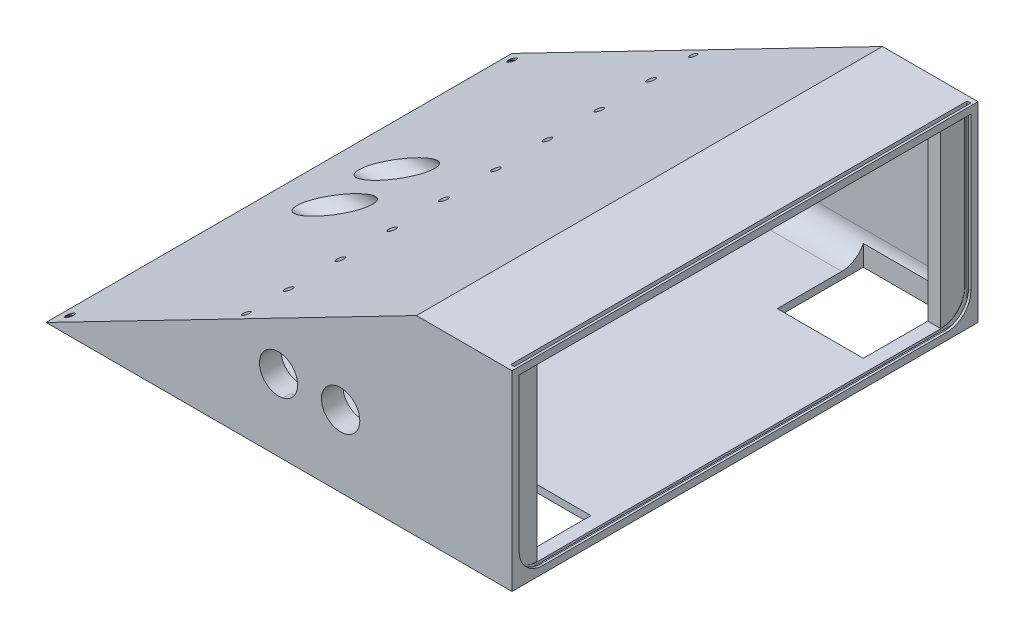
from build123d import *

# Parameters (mm, degrees)
ROBOT_DEPTH                 = 195
VACIO_POR_DENTRO_3MM_T      = -3
SKETCH3_R                   = 8.02
ULTRASONICO_DERECHA_DEPTH   = 3
SKETCH9_R                   = 8.2
ULTRASONICO_IZQUIERDA_DEPTH = 3
ULTRASONICO_CENTRO_R        = 8.7
CUT_EXTRUDE4_DEPTH          = 75
SKETCH16_R                  = 8.685660505
SKETCH16_R_2                = 8.02
BOSS_EXTRUDE1_DEPTH         = 9
SKETCH18_R                  = 8.7
SKETCH18_R_2                = 8.2
SKETCH18_R_3                = 8.719213476
BOSS_EXTRUDE2_DEPTH         = 60
SKETCH10_W                  = 37
SKETCH10_H                  = 37
RUEDA_DERECHA_DEPTH         = 3
SKETCH12_W                  = 36
SKETCH12_H                  = 36
RUEDA_IZQUIERDA_DEPTH       = 3
SKETCH14_W                  = 7.1
SKETCH14_H                  = 7.1
CYN70_DERECHA_DEPTH         = 4
SKETCH15_W                  = 7.1
SKETCH15_H                  = 7.1
CNY70_CENTRO_DEPTH          = 4
SKETCH13_W                  = 7.1
SKETCH13_H                  = 7.1
CNY70_IZQUIERDA_DEPTH       = 4
RDONDEO_R                   = 10
SKETCH23_W                  = 76.592532913
SKETCH23_H                  = 65.967934853
CUT_EXTRUDE5_DEPTH          = 25
SKETCH24_W                  = 1.5
SKETCH24_H                  = 191
CUT_EXTRUDE6_DEPTH          = 78
SKETCH25_W                  = 5.39966948
SKETCH25_H                  = 12.093031456
BOSS_EXTRUDE3_DEPTH         = 75
SKETCH38_W                  = 8.026655699
SKETCH38_H                  = 8.306480136
SKETCH38_W_2                = 7.026655699
SKETCH38_H_2                = 7.306480136
SKETCH38_H_3                = 8.585210253
SKETCH38_H_4                = 7.585210253
SKETCH38_H_5                = 8.264160011
SKETCH38_H_6                = 7.264160011
BOSS_EXTRUDE4_DEPTH         = 6
SKETCH40_R                  = 1.7
SKETCH40_R_2                = 1.52
AGUJEROS_RAMPA_DEPTH        = 3


with BuildPart() as part:
    # Sketch2 → Robot (new body)
    with BuildSketch(Plane.XY):
        Polygon((0, 0), (195, 0), (195, 80), (155, 80), align=None)
    extrude(amount=ROBOT_DEPTH)

    # Vacio por dentro 3mm
    vacio_por_dentro_3mm_openings = [part.faces().sort_by_distance(p)[0] for p in [
        (195, 40, 97.5),
    ]]
    offset(amount=VACIO_POR_DENTRO_3MM_T, openings=vacio_por_dentro_3mm_openings, kind=Kind.INTERSECTION)

    # Sketch3 → Ultrasonico Derecha (cut)
    with BuildSketch(Plane.XY.offset(195)):
        with Locations((97.289863967, 30)):
            Circle(SKETCH3_R)
        with Locations((123.289863967, 30)):
            Circle(SKETCH3_R)
    extrude(amount=-ULTRASONICO_DERECHA_DEPTH, mode=Mode.SUBTRACT)

    # Sketch9 → Ultrasonico Izquierda (cut)
    with BuildSketch(Plane(origin=(0, 0, 0), x_dir=(-1, 0, 0), z_dir=(0, 0, -1))):
        with Locations((-97.284004153, 30)):
            Circle(SKETCH9_R)
        with Locations((-123.284004153, 30)):
            Circle(SKETCH9_R)
    extrude(amount=-ULTRASONICO_IZQUIERDA_DEPTH, mode=Mode.SUBTRACT)

    # Ultrasonico Centro → Cut-Extrude4 (cut)
    with BuildSketch(Plane(origin=(0, 0, 0), x_dir=(0, 0, -1), z_dir=(1, 0, 0))):
        with Locations(Location((-85, 19, 0), (0, 0, 270))):
            Circle(ULTRASONICO_CENTRO_R)
        with Locations(Location((-111, 19, 0), (0, 0, 270))):
            Circle(ULTRASONICO_CENTRO_R)
    extrude(amount=CUT_EXTRUDE4_DEPTH, mode=Mode.SUBTRACT)

    # Sketch16 → Boss-Extrude1 (add)
    # profile 1 of 2: a face of its own
    with BuildSketch(Plane.XY.offset(195)):
        with Locations((123.289863967, 30)):
            Circle(SKETCH16_R)
        with Locations((123.289863967, 30)):
            Circle(SKETCH16_R_2, mode=Mode.SUBTRACT)
    # profile 2 of 2: a face of its own
    with BuildSketch(Plane.XY.offset(195)):
        with Locations((97.335124092, 30.010684101)):
            Circle(SKETCH16_R)
        with Locations((97.335124092, 30.010684101)):
            Circle(SKETCH16_R_2, mode=Mode.SUBTRACT)
    boss_extrude1 = extrude(amount=-BOSS_EXTRUDE1_DEPTH)

    # Sketch18 → Boss-Extrude2 (add)
    # profile 1 of 2: a face of its own
    with BuildSketch(Plane(origin=(1, 0, 0), x_dir=(0, 0, -1), z_dir=(1, 0, 0))):
        with Locations(Location((-85, 19, 0), (0, 0, 270))):
            Circle(SKETCH18_R)
        with Locations((-85, 19)):
            Circle(SKETCH18_R_2, mode=Mode.SUBTRACT)
    # profile 2 of 2: a face of its own
    with BuildSketch(Plane(origin=(1, 0, 0), x_dir=(0, 0, -1), z_dir=(1, 0, 0))):
        with Locations(Location((-111, 19, 0), (0, 0, 270))):
            Circle(SKETCH18_R_3)
        with Locations((-111, 19)):
            Circle(SKETCH18_R_2, mode=Mode.SUBTRACT)
    extrude(amount=BOSS_EXTRUDE2_DEPTH)

    # Mirror1: Boss-Extrude1 across plane
    add(boss_extrude1.mirror(Plane.XY.offset(97.5)))

    # Sketch10 → Rueda Derecha (cut)
    with BuildSketch(Plane(origin=(0, 0, 0), x_dir=(-1, 0, 0), z_dir=(0, -1, 0))):
        with Locations((-168.5, -172.5)):
            Rectangle(SKETCH10_W, SKETCH10_H)
    extrude(amount=-RUEDA_DERECHA_DEPTH, mode=Mode.SUBTRACT)

    # Sketch12 → Rueda Izquierda (cut)
    with BuildSketch(Plane(origin=(0, 0, 0), x_dir=(-1, 0, 0), z_dir=(0, -1, 0))):
        with Locations((-169, -22)):
            Rectangle(SKETCH12_W, SKETCH12_H)
    extrude(amount=-RUEDA_IZQUIERDA_DEPTH, mode=Mode.SUBTRACT)

    # Sketch14 → Cyn70 Derecha (cut)
    with BuildSketch(Plane(origin=(0, 0, 0), x_dir=(-1, 0, 0), z_dir=(0, -1, 0))):
        with Locations((-29.55, -183.45)):
            Rectangle(SKETCH14_W, SKETCH14_H)
    extrude(amount=-CYN70_DERECHA_DEPTH, mode=Mode.SUBTRACT)

    # Sketch15 → Cny70 Centro (cut)
    with BuildSketch(Plane(origin=(0, 0, 0), x_dir=(-1, 0, 0), z_dir=(0, -1, 0))):
        with Locations((-29.55, -97.5)):
            Rectangle(SKETCH15_W, SKETCH15_H)
    extrude(amount=-CNY70_CENTRO_DEPTH, mode=Mode.SUBTRACT)

    # Sketch13 → Cny70 Izquierda (cut)
    with BuildSketch(Plane.XZ):
        with Locations((29.55, 11.55)):
            Rectangle(SKETCH13_W, SKETCH13_H)
    extrude(amount=-CNY70_IZQUIERDA_DEPTH, mode=Mode.SUBTRACT)

    # Rdondeo
    # the kernel refuses this fillet: 10 mm, written as the material it adds along each edge
    with BuildSketch(Plane(origin=(-12.646463672, 3, 3), x_dir=(0, 0, 1), z_dir=(1, 0, 0))) as rdondeo_piece_1_section:
        with BuildLine():
            CenterArc((RDONDEO_R, -RDONDEO_R), RDONDEO_R, 90, 90)
            Line((0, -RDONDEO_R), (0, 0))
            Line((0, 0), (RDONDEO_R, 0))
        make_face()
    rdondeo_piece_1 = extrude(amount=232.646463672, mode=Mode.PRIVATE)
    rdondeo_piece_1 = split(rdondeo_piece_1, bisect_by=Plane(origin=(26, 3.382720795, 9.257724248), z_dir=(-1, 0, 0)), keep=Keep.TOP, mode=Mode.PRIVATE)
    rdondeo_piece_1 = split(rdondeo_piece_1, bisect_by=Plane(origin=(18.190230172, 6.012487145, 9.257724248), z_dir=(0.4586429197702524, -0.8886206570548638, 0)), keep=Keep.TOP, mode=Mode.PRIVATE)
    add(rdondeo_piece_1)
    with BuildSketch(Plane(origin=(-12.646463672, 3, 3), x_dir=(0, 0, 1), z_dir=(1, 0, 0))) as rdondeo_piece_2_section:
        with BuildLine():
            CenterArc((RDONDEO_R, -RDONDEO_R), RDONDEO_R, 90, 90)
            Line((0, -RDONDEO_R), (0, 0))
            Line((0, 0), (RDONDEO_R, 0))
        make_face()
    rdondeo_piece_2 = extrude(amount=232.646463672, mode=Mode.PRIVATE)
    rdondeo_piece_2 = split(rdondeo_piece_2, bisect_by=Plane(origin=(29.55, 4.766890381, 8), z_dir=(0, 0, -1)), keep=Keep.TOP, mode=Mode.PRIVATE)
    rdondeo_piece_2 = split(rdondeo_piece_2, bisect_by=Plane(origin=(151, 4.766890381, 5.549307676), z_dir=(-1, 0, 0)), keep=Keep.TOP, mode=Mode.PRIVATE)
    rdondeo_piece_2 = split(rdondeo_piece_2, bisect_by=Plane(origin=(26.652779728, 10.380254658, 5.549307676), z_dir=(0.4586429197702524, -0.8886206570548638, 0)), keep=Keep.TOP, mode=Mode.PRIVATE)
    add(rdondeo_piece_2)
    with BuildSketch(Plane(origin=(-12.646463672, 3, 3), x_dir=(0, 0, 1), z_dir=(1, 0, 0))) as rdondeo_piece_3_section:
        with BuildLine():
            CenterArc((RDONDEO_R, -RDONDEO_R), RDONDEO_R, 90, 90)
            Line((0, -RDONDEO_R), (0, 0))
            Line((0, 0), (RDONDEO_R, 0))
        make_face()
    rdondeo_piece_3 = extrude(amount=232.646463672, mode=Mode.PRIVATE)
    rdondeo_piece_3 = split(rdondeo_piece_3, bisect_by=Plane(origin=(33.1, 3.396845927, 9.232636126), z_dir=(1, 0, 0)), keep=Keep.TOP, mode=Mode.PRIVATE)
    rdondeo_piece_3 = split(rdondeo_piece_3, bisect_by=Plane(origin=(151, 3.396845927, 9.232636126), z_dir=(-1, 0, 0)), keep=Keep.TOP, mode=Mode.PRIVATE)
    add(rdondeo_piece_3)
    with BuildSketch(Plane(origin=(-12.646463672, 3, 3), x_dir=(0, 0, 1), z_dir=(1, 0, 0))) as rdondeo_piece_4_section:
        with BuildLine():
            CenterArc((RDONDEO_R, -RDONDEO_R), RDONDEO_R, 90, 90)
            Line((0, -RDONDEO_R), (0, 0))
            Line((0, 0), (RDONDEO_R, 0))
        make_face()
    rdondeo_piece_4 = extrude(amount=207.646463672, mode=Mode.PRIVATE)
    rdondeo_piece_4 = split(rdondeo_piece_4, bisect_by=Plane(origin=(187, 3.396845927, 9.232636126), z_dir=(1, 0, 0)), keep=Keep.TOP, mode=Mode.PRIVATE)
    add(rdondeo_piece_4)
    with BuildSketch(Plane(origin=(-12.646463672, 3, 3), x_dir=(0, 0, 1), z_dir=(1, 0, 0))) as rdondeo_piece_5_section:
        with BuildLine():
            CenterArc((RDONDEO_R, -RDONDEO_R), RDONDEO_R, 90, 90)
            Line((0, -RDONDEO_R), (0, 0))
            Line((0, 0), (RDONDEO_R, 0))
        make_face()
    rdondeo_piece_5 = extrude(amount=232.646463672, mode=Mode.PRIVATE)
    rdondeo_piece_5 = split(rdondeo_piece_5, bisect_by=Plane(origin=(187, 6.605810426, 3.459165083), z_dir=(-1, 0, 0)), keep=Keep.TOP, mode=Mode.PRIVATE)
    rdondeo_piece_5 = split(rdondeo_piece_5, bisect_by=Plane(origin=(169, 6.605810426, 4), z_dir=(0, 0, -1)), keep=Keep.TOP, mode=Mode.PRIVATE)
    rdondeo_piece_5 = split(rdondeo_piece_5, bisect_by=Plane(origin=(137.518477626, 67.601260025, 3.459165083), z_dir=(0.4586429197702524, -0.8886206570548638, 0)), keep=Keep.TOP, mode=Mode.PRIVATE)
    add(rdondeo_piece_5)
    with BuildSketch(Plane(origin=(-12.646463672, 3, 192), x_dir=(0, 0, -1), z_dir=(1, 0, 0))) as rdondeo_piece_6_section:
        with BuildLine():
            CenterArc((RDONDEO_R, RDONDEO_R), RDONDEO_R, 180, 90)
            Line((0, RDONDEO_R), (0, 0))
            Line((0, 0), (RDONDEO_R, 0))
        make_face()
    rdondeo_piece_6 = extrude(amount=232.646463672, mode=Mode.PRIVATE)
    rdondeo_piece_6 = split(rdondeo_piece_6, bisect_by=Plane(origin=(26, 3.382720795, 185.742275752), z_dir=(-1, 0, 0)), keep=Keep.TOP, mode=Mode.PRIVATE)
    rdondeo_piece_6 = split(rdondeo_piece_6, bisect_by=Plane(origin=(18.190230172, 6.012487145, 185.742275752), z_dir=(0.4586429197702524, -0.8886206570548638, 0)), keep=Keep.TOP, mode=Mode.PRIVATE)
    add(rdondeo_piece_6)
    with BuildSketch(Plane(origin=(-12.646463672, 3, 192), x_dir=(0, 0, -1), z_dir=(1, 0, 0))) as rdondeo_piece_7_section:
        with BuildLine():
            CenterArc((RDONDEO_R, RDONDEO_R), RDONDEO_R, 180, 90)
            Line((0, RDONDEO_R), (0, 0))
            Line((0, 0), (RDONDEO_R, 0))
        make_face()
    rdondeo_piece_7 = extrude(amount=232.646463672, mode=Mode.PRIVATE)
    rdondeo_piece_7 = split(rdondeo_piece_7, bisect_by=Plane(origin=(29.55, 4.766890381, 187), z_dir=(0, 0, 1)), keep=Keep.TOP, mode=Mode.PRIVATE)
    rdondeo_piece_7 = split(rdondeo_piece_7, bisect_by=Plane(origin=(150, 4.766890381, 189.450692324), z_dir=(-1, 0, 0)), keep=Keep.TOP, mode=Mode.PRIVATE)
    rdondeo_piece_7 = split(rdondeo_piece_7, bisect_by=Plane(origin=(26.652779728, 10.380254658, 189.450692324), z_dir=(0.4586429197702524, -0.8886206570548638, 0)), keep=Keep.TOP, mode=Mode.PRIVATE)
    add(rdondeo_piece_7)
    with BuildSketch(Plane(origin=(-12.646463672, 3, 192), x_dir=(0, 0, -1), z_dir=(1, 0, 0))) as rdondeo_piece_8_section:
        with BuildLine():
            CenterArc((RDONDEO_R, RDONDEO_R), RDONDEO_R, 180, 90)
            Line((0, RDONDEO_R), (0, 0))
            Line((0, 0), (RDONDEO_R, 0))
        make_face()
    rdondeo_piece_8 = extrude(amount=232.646463672, mode=Mode.PRIVATE)
    rdondeo_piece_8 = split(rdondeo_piece_8, bisect_by=Plane(origin=(33.1, 3.396845927, 185.767363874), z_dir=(1, 0, 0)), keep=Keep.TOP, mode=Mode.PRIVATE)
    rdondeo_piece_8 = split(rdondeo_piece_8, bisect_by=Plane(origin=(150, 3.396845927, 185.767363874), z_dir=(-1, 0, 0)), keep=Keep.TOP, mode=Mode.PRIVATE)
    add(rdondeo_piece_8)
    with BuildSketch(Plane(origin=(-12.646463672, 3, 192), x_dir=(0, 0, -1), z_dir=(1, 0, 0))) as rdondeo_piece_9_section:
        with BuildLine():
            CenterArc((RDONDEO_R, RDONDEO_R), RDONDEO_R, 180, 90)
            Line((0, RDONDEO_R), (0, 0))
            Line((0, 0), (RDONDEO_R, 0))
        make_face()
    rdondeo_piece_9 = extrude(amount=207.646463672, mode=Mode.PRIVATE)
    rdondeo_piece_9 = split(rdondeo_piece_9, bisect_by=Plane(origin=(187, 3.396845927, 185.767363874), z_dir=(1, 0, 0)), keep=Keep.TOP, mode=Mode.PRIVATE)
    add(rdondeo_piece_9)
    with BuildSketch(Plane(origin=(-12.646463672, 3, 192), x_dir=(0, 0, -1), z_dir=(1, 0, 0))) as rdondeo_piece_10_section:
        with BuildLine():
            CenterArc((RDONDEO_R, RDONDEO_R), RDONDEO_R, 180, 90)
            Line((0, RDONDEO_R), (0, 0))
            Line((0, 0), (RDONDEO_R, 0))
        make_face()
    rdondeo_piece_10 = extrude(amount=232.646463672, mode=Mode.PRIVATE)
    rdondeo_piece_10 = split(rdondeo_piece_10, bisect_by=Plane(origin=(187, 6.605810426, 191.540834917), z_dir=(-1, 0, 0)), keep=Keep.TOP, mode=Mode.PRIVATE)
    rdondeo_piece_10 = split(rdondeo_piece_10, bisect_by=Plane(origin=(168.5, 6.605810426, 191), z_dir=(0, 0, 1)), keep=Keep.TOP, mode=Mode.PRIVATE)
    rdondeo_piece_10 = split(rdondeo_piece_10, bisect_by=Plane(origin=(137.12365429, 67.397480238, 191.540834917), z_dir=(0.4586429197702524, -0.8886206570548638, 0)), keep=Keep.TOP, mode=Mode.PRIVATE)
    add(rdondeo_piece_10)

    # Sketch23 → Cut-Extrude5 (cut)
    with BuildSketch(Plane(origin=(0, 0, 0), x_dir=(0.8886206570548638, 0.45864291977025234, 0), z_dir=(-0.4586429197702524, 0.8886206570548639, 0))):
        with Locations((38.296266456, -97.30278137)):
            Rectangle(SKETCH23_W, SKETCH23_H)
    extrude(amount=CUT_EXTRUDE5_DEPTH, mode=Mode.SUBTRACT)

    # Sketch24 → Cut-Extrude6 (cut)
    with BuildSketch(Plane(origin=(0, 80, 0), x_dir=(1, 0, 0), z_dir=(0, 1, 0))):
        with Locations((193.25, -97.5)):
            Rectangle(SKETCH24_W, SKETCH24_H)
    extrude(amount=-CUT_EXTRUDE6_DEPTH, mode=Mode.SUBTRACT)

    # Sketch25 → Boss-Extrude3 (add)
    with BuildSketch(Plane(origin=(0, 3, 0), x_dir=(1, 0, 0), z_dir=(0, 1, 0))):
        with Locations((189.69983474, -6.953484272)):
            Rectangle(SKETCH25_W, SKETCH25_H)
    boss_extrude3 = extrude(amount=BOSS_EXTRUDE3_DEPTH)

    # Mirror2: Boss-Extrude3 across plane
    add(boss_extrude3.mirror(Plane.XY.offset(97.5)))

    # Sketch37 → Avellanado para tornillo con cabeza plana de M31 (revolve, cut)
    with BuildSketch(Plane(origin=(190, 0, 190), x_dir=(0, 0, -1), z_dir=(1, 0, 0))):
        Polygon((0, 0), (0, 10.96137699), (1.6, 10), (1.6, 1.55), (3.15, 0), align=None)
    avellanado_para_tornillo_con_cabeza_plan = revolve(axis=Axis((190, -6.35, 190), (0, 1, 0)), mode=Mode.SUBTRACT)

    # Mirror4: Avellanado para tornillo con cabeza plana de M31 across plane
    add(avellanado_para_tornillo_con_cabeza_plan.mirror(Plane.XY.offset(97.5)), mode=Mode.SUBTRACT)

    # Mirror5: Avellanado para tornillo con cabeza plana de M31 across plane
    add(avellanado_para_tornillo_con_cabeza_plan.mirror(Plane(origin=(97.5, 0, 0), x_dir=(0, 0, 1), z_dir=(1, 0, 0))), mode=Mode.SUBTRACT)

    # Mirror5 copy 1 sketch → Mirror5 copy 1 (revolve, cut)
    with BuildSketch(Plane(origin=(5, 0, 5), x_dir=(0, 0, 1), z_dir=(-1, 0, 0))):
        Polygon((0, 0), (0, 10.96137699), (1.6, 10), (1.6, 1.55), (3.15, 0), align=None)
    revolve(axis=Axis((5, -6.35, 5), (0, 1, 0)), mode=Mode.SUBTRACT)

    # Sketch38 → Boss-Extrude4 (add)
    # profile 1 of 3: a face of its own
    with BuildSketch(Plane(origin=(0, 0, 0), x_dir=(1, 0, 0), z_dir=(0, 1, 0))):
        with Locations((29.586672151, -11.653240068)):
            Rectangle(SKETCH38_W, SKETCH38_H)
        with Locations((29.586672151, -11.653240068)):
            Rectangle(SKETCH38_W_2, SKETCH38_H_2, mode=Mode.SUBTRACT)
    # profile 2 of 3: a face of its own
    with BuildSketch(Plane(origin=(0, 0, 0), x_dir=(1, 0, 0), z_dir=(0, 1, 0))):
        with Locations((29.586672151, -97.742605126)):
            Rectangle(SKETCH38_W, SKETCH38_H_3)
        with Locations((29.586672151, -97.742605126)):
            Rectangle(SKETCH38_W_2, SKETCH38_H_4, mode=Mode.SUBTRACT)
    # profile 3 of 3: a face of its own
    with BuildSketch(Plane(origin=(0, 0, 0), x_dir=(1, 0, 0), z_dir=(0, 1, 0))):
        with Locations((29.586672151, -183.532080006)):
            Rectangle(SKETCH38_W, SKETCH38_H_5)
        with Locations((29.586672151, -183.532080006)):
            Rectangle(SKETCH38_W_2, SKETCH38_H_6, mode=Mode.SUBTRACT)
    extrude(amount=BOSS_EXTRUDE4_DEPTH)

    # Sketch40 → Agujeros rampa (cut)
    with BuildSketch(Plane(origin=(0, 0, 0), x_dir=(0.8886206570548638, 0.45864291977025234, 0), z_dir=(-0.4586429197702524, 0.8886206570548639, 0))):
        with Locations(Location((89.877096201, -21.666666667, 0), (0, 0, 180))):
            Circle(SKETCH40_R)
        with Locations(Location((89.877096201, -43.333333333, 0), (0, 0, 180))):
            Circle(SKETCH40_R)
        with Locations(Location((89.877096201, -65, 0), (0, 0, 180))):
            Circle(SKETCH40_R)
        with Locations(Location((89.877096201, -86.666666667, 0), (0, 0, 180))):
            Circle(SKETCH40_R)
        with Locations(Location((89.877096201, -4, 0), (0, 0, 180))):
            Circle(SKETCH40_R_2)
    agujeros_rampa = extrude(amount=-AGUJEROS_RAMPA_DEPTH, mode=Mode.SUBTRACT)

    # Mirror7: Agujeros rampa across plane
    add(agujeros_rampa.mirror(Plane.XY.offset(97.5)), mode=Mode.SUBTRACT)


solid = part.part
